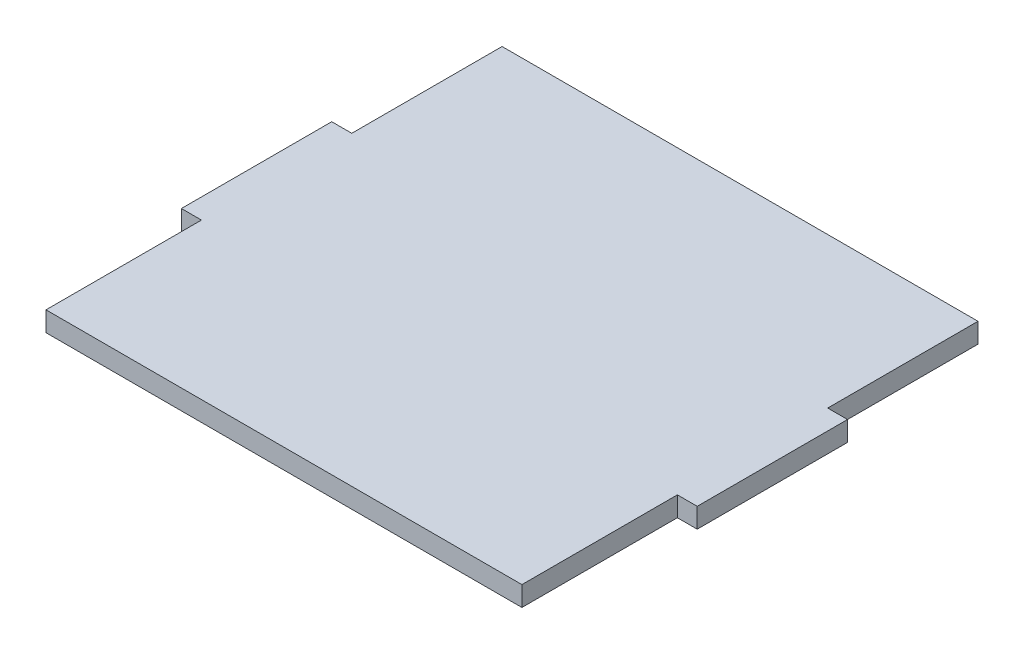
from build123d import *

# Parameters (mm, degrees)
ESQUISSE1_W              = 52
ESQUISSE1_H              = 50
BOSS_EXTRU_1_DEPTH       = 2
EMPREINTE1_START         = -50
EMPREINTE1_OUTLINE_W     = 2.02
EMPREINTE1_OUTLINE_H     = 2
EMPREINTE1_OUTLINE_W_2   = 49.9598
EMPREINTE1_DEPTH         = 2.02
EMPREINTE1_START_2       = -2
EMPREINTE1_2_OUTLINE_W   = 2.02
EMPREINTE1_2_OUTLINE_H   = 2
EMPREINTE1_2_OUTLINE_W_2 = 49.9598
EMPREINTE1_2_DEPTH       = 2
EMPREINTE1_START_3       = -17.67235879
EMPREINTE1_3_OUTLINE_W   = 2.02
EMPREINTE1_3_OUTLINE_H   = 2
EMPREINTE1_3_OUTLINE_W_2 = 2
EMPREINTE1_3_DEPTH       = 15.67235879
EMPREINTE1_START_4       = -47.98
EMPREINTE1_4_OUTLINE_W   = 2.02
EMPREINTE1_4_OUTLINE_H   = 2
EMPREINTE1_4_OUTLINE_W_2 = 2
EMPREINTE1_4_DEPTH       = 15.15235879
ESQUISSE2_W              = 9.61940452
ESQUISSE2_H              = 3.700848348
ESQUISSE2_W_2            = 14.786584651
ESQUISSE2_H_2            = 4.070824207
ENL_V_MAT_EXTRU_1_DEPTH  = 2


# Read off the part's stored shape, not the designer's step: Empreinte1
with BuildPart() as part:
    # Esquisse1 → Boss.-Extru.1 (new body)
    with BuildSketch(Plane(origin=(0, 0, 0), x_dir=(1, 0, 0), z_dir=(0, 1, 0))):
        with Locations((26, 25)):
            Rectangle(ESQUISSE1_W, ESQUISSE1_H)
    extrude(amount=BOSS_EXTRU_1_DEPTH)

    # Empreinte1 outline → Empreinte1 (cut)
    with BuildSketch(Plane.XY.offset(EMPREINTE1_START)):
        with Locations((1.01, 1)):
            Rectangle(EMPREINTE1_OUTLINE_W, EMPREINTE1_OUTLINE_H)
        with Locations((27.0201, 1)):
            Rectangle(EMPREINTE1_OUTLINE_W_2, EMPREINTE1_OUTLINE_H)
    extrude(amount=EMPREINTE1_DEPTH, mode=Mode.SUBTRACT)

    # Empreinte1 2 outline → Empreinte1 2 (cut)
    with BuildSketch(Plane.XY.offset(EMPREINTE1_START_2)):
        with Locations((1.01, 1)):
            Rectangle(EMPREINTE1_2_OUTLINE_W, EMPREINTE1_2_OUTLINE_H)
        with Locations((27.0201, 1)):
            Rectangle(EMPREINTE1_2_OUTLINE_W_2, EMPREINTE1_2_OUTLINE_H)
    extrude(amount=EMPREINTE1_2_DEPTH, mode=Mode.SUBTRACT)

    # Empreinte1 3 outline → Empreinte1 3 (cut)
    with BuildSketch(Plane.XY.offset(EMPREINTE1_START_3)):
        with Locations((1.01, 1)):
            Rectangle(EMPREINTE1_3_OUTLINE_W, EMPREINTE1_3_OUTLINE_H)
        with Locations((51, 1)):
            Rectangle(EMPREINTE1_3_OUTLINE_W_2, EMPREINTE1_3_OUTLINE_H)
    extrude(amount=EMPREINTE1_3_DEPTH, mode=Mode.SUBTRACT)

    # Empreinte1 4 outline → Empreinte1 4 (cut)
    with BuildSketch(Plane.XY.offset(EMPREINTE1_START_4)):
        with Locations((1.01, 1)):
            Rectangle(EMPREINTE1_4_OUTLINE_W, EMPREINTE1_4_OUTLINE_H)
        with Locations((51, 1)):
            Rectangle(EMPREINTE1_4_OUTLINE_W_2, EMPREINTE1_4_OUTLINE_H)
    extrude(amount=EMPREINTE1_4_DEPTH, mode=Mode.SUBTRACT)

    # Esquisse2 → Enlèv. mat.-Extru.1 (cut)
    with BuildSketch(Plane(origin=(0, 2, 0), x_dir=(1, 0, 0), z_dir=(0, 1, 0))):
        with Locations((1.626508817, 49.830424174)):
            Rectangle(ESQUISSE2_W, ESQUISSE2_H)
        with Locations((5.120042554, -0.035412104)):
            Rectangle(ESQUISSE2_W_2, ESQUISSE2_H_2)
    extrude(amount=-ENL_V_MAT_EXTRU_1_DEPTH, mode=Mode.SUBTRACT)


solid = part.part
